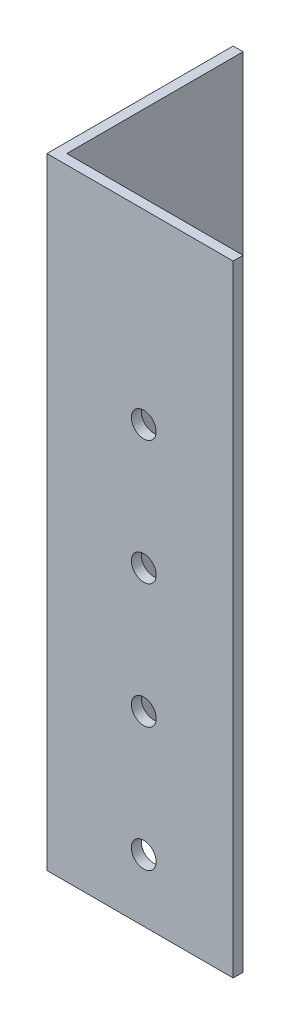
from build123d import *

# Parameters (mm, degrees)
EXTRUDE_1_DEPTH     = 250
SKETCH_6_R          = 5
CUT_EXTRUDE_1_DEPTH = 10
SKETCH_7_R          = 5
CUT_EXTRUDE_2_DEPTH = 10


with BuildPart() as part:
    # Эскиз1 → Вытянуть-Тонкостенный1 (new body)
    with BuildSketch(Plane(origin=(0, 0, 0), x_dir=(1, 0, 0), z_dir=(0, 1, 0))):
        Polygon((0, 75), (0, 0), (75, 0), (75, 4), (4, 4), (4, 75), align=None)
    extrude(amount=EXTRUDE_1_DEPTH)

    # Эскиз6 → Вырез-Вытянуть1 (cut)
    with BuildSketch(Plane.ZY):
        with Locations((-39, 25)):
            Circle(SKETCH_6_R)
        with Locations((-39, 75)):
            Circle(SKETCH_6_R)
        with Locations((-39, 125)):
            Circle(SKETCH_6_R)
        with Locations((-39, 175)):
            Circle(SKETCH_6_R)
    extrude(amount=-CUT_EXTRUDE_1_DEPTH, mode=Mode.SUBTRACT)

    # Эскиз7 → Вырез-Вытянуть2 (cut)
    with BuildSketch(Plane.XY):
        with Locations((39, 25)):
            Circle(SKETCH_7_R)
        with Locations((39, 75)):
            Circle(SKETCH_7_R)
        with Locations((39, 125)):
            Circle(SKETCH_7_R)
        with Locations((39, 175)):
            Circle(SKETCH_7_R)
    extrude(amount=-CUT_EXTRUDE_2_DEPTH, mode=Mode.SUBTRACT)


solid = part.part
